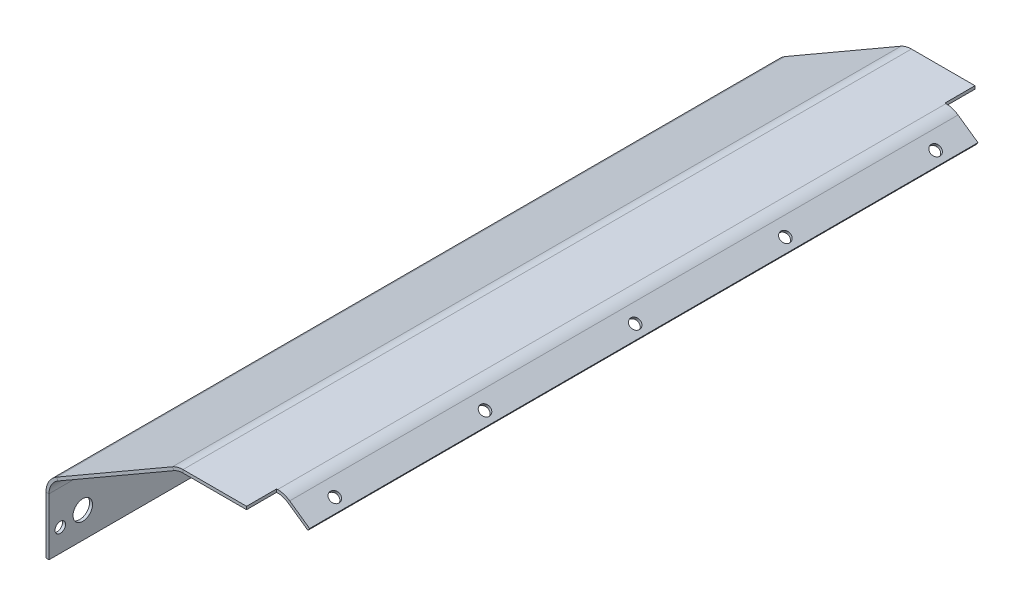
from build123d import *

# Parameters (mm, degrees)
BASIS_BLECH1_DEPTH               = 242.5
SKIZZE4_W                        = 22
SKIZZE4_H                        = 20
SCHNITT_LINEAR_AUSTRAGEN1_DEPTH  = 303.852114579
F_7_0_7_DURCHMESSER_BOHRUNG1_D   = 7
F_13_0_13_DURCHMESSER_BOHRUNG1_D = 13
F_7_0_7_DURCHMESSER_BOHRUNG2_D   = 7


# Sheet-metal steps are written as plain solids
with BuildPart() as part:
    # Skizze1 → Basis-Blech1 (new, symmetric)
    with BuildSketch(Plane.XY):
        with BuildLine():
            Line((0, -22.5), (0, 15.57179677))
            ThreePointArc((0, 15.57179677), (1.607695155, 21.57179677), (6, 25.964101615))
            Line((6, 25.964101615), (83.215390309, 70.544427996))
            ThreePointArc((83.215390309, 70.544427996), (86.109561768, 71.743233066), (89.215390309, 72.15212315))
            Line((89.215390309, 72.15212315), (132.216414533, 72.15212315))
            ThreePointArc((132.216414533, 72.15212315), (135.824884128, 71.596726559), (139.09933177, 69.981947682))
            Line((139.09933177, 69.981947682), (152.383040886, 60.680594423))
            Line((152.383040886, 60.680594423), (153.530193758, 62.318898512))
            Line((153.530193758, 62.318898512), (140.246484642, 71.62025177))
            ThreePointArc((140.246484642, 71.62025177), (136.426295727, 73.504160461), (132.216414533, 74.15212315))
            Line((132.216414533, 74.15212315), (89.215390309, 74.15212315))
            ThreePointArc((89.215390309, 74.15212315), (85.591923678, 73.675084718), (82.215390309, 72.276478803))
            Line((82.215390309, 72.276478803), (5, 27.696152423))
            ThreePointArc((5, 27.696152423), (-0.124355653, 22.57179677), (-2, 15.57179677))
            Line((-2, 15.57179677), (-2, -22.5))
            Line((-2, -22.5), (0, -22.5))
        make_face()
    extrude(amount=BASIS_BLECH1_DEPTH, both=True)

    # Skizze4 → Schnitt-Linear austragen1 (cut, through all)
    with BuildSketch(Plane(origin=(0, 74.15212315, 0), x_dir=(1, 0, 0), z_dir=(0, 1, 0))):
        with Locations((142.530193758, 232.5)):
            Rectangle(SKIZZE4_W, SKIZZE4_H)
        with Locations((142.530193758, -232.5)):
            Rectangle(SKIZZE4_W, SKIZZE4_H)
    extrude(amount=-SCHNITT_LINEAR_AUSTRAGEN1_DEPTH, mode=Mode.SUBTRACT)

    # Ø7.0 (7) Durchmesser Bohrung1 (through all)
    with Locations(Plane(origin=(-2, 72.15212315, 0), x_dir=(0, -1, 0), z_dir=(-1, 0, 0))):
        with Locations((79.65212315, 235), (79.65212315, -235)):
            Hole(F_7_0_7_DURCHMESSER_BOHRUNG1_D / 2)

    # Ø13.0 (13) Durchmesser Bohrung1 (through all)
    with Locations(Plane.ZY.offset(2)):
        with Locations((-220, -5), (220, -5)):
            Hole(F_13_0_13_DURCHMESSER_BOHRUNG1_D / 2)

    # Ø7.0 (7) Durchmesser Bohrung2 (through all)
    with Locations(Plane(origin=(79.790191976, 113.952203628, 0), x_dir=(0, 0, -1), z_dir=(0.5735764363510463, 0.8191520442889918, 0))):
        with Locations((0, -83.019920352), (-100, -83.019920352), (-200, -83.019920352), (100, -83.019920352), (200, -83.019920352)):
            Hole(F_7_0_7_DURCHMESSER_BOHRUNG2_D / 2)


solid = part.part
